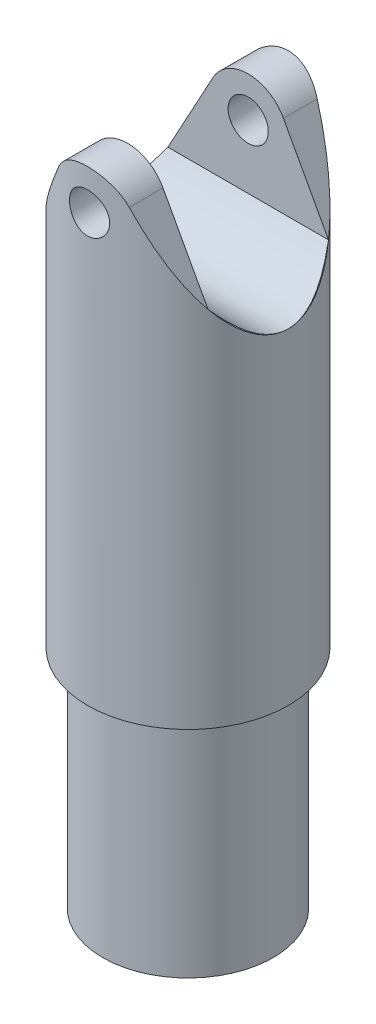
from build123d import *
from OCP.BRepAlgoAPI import BRepAlgoAPI_Cut
from OCP.TopTools import TopTools_ListOfShape

# Parameters (mm, degrees)
SKETCH_1_R          = 17
EXTRUDE_1_DEPTH     = 45
SKETCH_2_R          = 20
EXTRUDE_2_DEPTH     = 95
CUT_EXTRUDE_3_DEPTH = 20
SKETCH_9_R          = 4
CUT_EXTRUDE_4_DEPTH = 20
CUT_EXTRUDE_5_DEPTH = 20


with BuildPart() as part:
    # 草图1 → 凸台-拉伸1 (new body)
    with BuildSketch(Plane(origin=(0, 0, 0), x_dir=(1, 0, 0), z_dir=(0, 1, 0))):
        Circle(SKETCH_1_R)
    extrude(amount=EXTRUDE_1_DEPTH)

    # 草图2 → 凸台-拉伸2 (add)
    with BuildSketch(Plane(origin=(0, 45, 0), x_dir=(1, 0, 0), z_dir=(0, 1, 0))):
        Circle(SKETCH_2_R)
    extrude(amount=EXTRUDE_2_DEPTH)

    # 草图8 → 切除-拉伸3 (cut, symmetric)
    with BuildSketch(Plane.XY):
        with BuildLine():
            Line((-20, 110), (-7.025863986, 133.825863986))
            ThreePointArc((-7.025863986, 133.825863986), (0, 137.999999999), (7.025863987, 133.825863986))
            Line((7.025863987, 133.825863986), (20, 110))
            Line((20, 110), (20, 140))
            Line((20, 140), (-20, 140))
            Line((-20, 140), (-20, 110))
        make_face()
    extrude(amount=CUT_EXTRUDE_3_DEPTH, both=True, mode=Mode.SUBTRACT)

    # 草图9 → 切除-拉伸4 (cut, symmetric)
    with BuildSketch(Plane.XY):
        with Locations((0, 130)):
            Circle(SKETCH_9_R)
    extrude(amount=CUT_EXTRUDE_4_DEPTH, both=True, mode=Mode.SUBTRACT)


with BuildPart() as cut_extrude_5_tool:
    # 草图10 → 切除-拉伸5 (new, symmetric)
    with BuildSketch(Plane(origin=(0, 0, 0), x_dir=(0, 0, -1), z_dir=(1, 0, 0))):
        with BuildLine():
            Line((0, 137.999999999), (12, 137.999999999))
            Line((12, 137.999999999), (12, 117.345649517))
            add(Edge.make_bspline(
                [(-12, 117.345649517), (0, 102.654350483), (12, 117.345649517)],
                knots=[0, 0, 0, 1, 1, 1], degree=2))
            Line((-12, 117.345649517), (-12, 137.999999999))
            Line((-12, 137.999999999), (0, 137.999999999))
        make_face()
    extrude(amount=CUT_EXTRUDE_5_DEPTH, both=True)


with BuildPart() as part_1:
    add(part.part)

    # 切除-拉伸5: cut by cut_extrude_5_tool, with a tolerance
    cut_extrude_5_stock = TopTools_ListOfShape()
    cut_extrude_5_stock.Append(part_1.part.wrapped)
    cut_extrude_5_tools = TopTools_ListOfShape()
    cut_extrude_5_tools.Append(cut_extrude_5_tool.part.wrapped)
    cut_extrude_5_cut = BRepAlgoAPI_Cut()
    cut_extrude_5_cut.SetArguments(cut_extrude_5_stock)
    cut_extrude_5_cut.SetTools(cut_extrude_5_tools)
    cut_extrude_5_cut.SetFuzzyValue(0.00001)
    cut_extrude_5_cut.Build()
    add(Compound.cast(cut_extrude_5_cut.Shape()).solids(), mode=Mode.REPLACE)


solid = part_1.part
